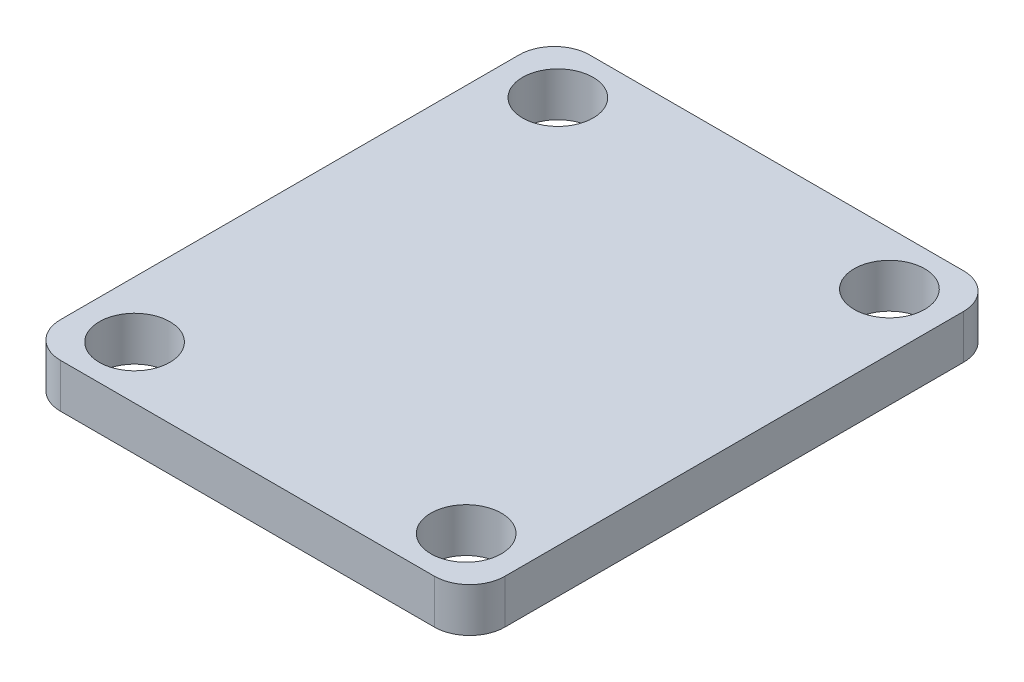
from build123d import *

# Parameters (mm, degrees)
SKETCH3_W           = 32.004
SKETCH3_H           = 38.1
BOSS_EXTRUDE1_DEPTH = 3.175
SKETCH4_R           = 2.54
CUT_EXTRUDE1_DEPTH  = 26.080811969
FILLET1_R           = 2.54


with BuildPart() as part:
    # Sketch3 → Boss-Extrude1 (new body)
    with BuildSketch(Plane(origin=(0, 0, 0), x_dir=(1, 0, 0), z_dir=(0, 1, 0))):
        Rectangle(SKETCH3_W, SKETCH3_H)
    extrude(amount=-BOSS_EXTRUDE1_DEPTH)

    # Sketch4 → Cut-Extrude1 (cut, through all)
    with BuildSketch(Plane(origin=(0, 0, 0), x_dir=(1, 0, 0), z_dir=(0, 1, 0))):
        with Locations((11.938, 15.24)):
            Circle(SKETCH4_R)
        with Locations((-11.938, 15.24)):
            Circle(SKETCH4_R)
        with Locations((-11.938, -15.24)):
            Circle(SKETCH4_R)
        with Locations((11.938, -15.24)):
            Circle(SKETCH4_R)
    extrude(amount=-CUT_EXTRUDE1_DEPTH, mode=Mode.SUBTRACT)

    # Fillet1
    fillet1_edges = [part.edges().sort_by_distance(p)[0] for p in [
        (-16.002, -1.5875, 19.05),
        (-16.002, -1.5875, -19.05),
        (16.002, -1.5875, -19.05),
        (16.002, -1.5875, 19.05),
    ]]
    fillet(fillet1_edges, radius=FILLET1_R)


solid = part.part
